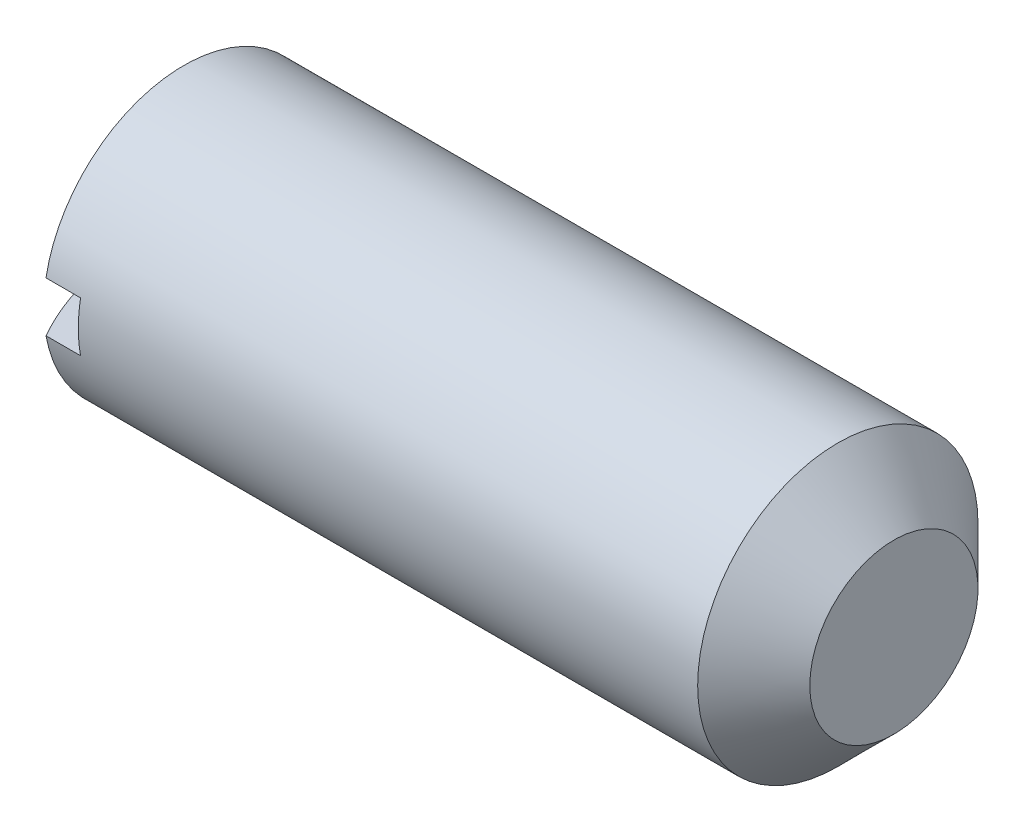
from build123d import *

# Parameters (mm, degrees)
SKETCH2_W  = 19.05
SKETCH2_H  = 3.4036
SLOT_DEPTH = 4.9022


with BuildPart() as part:
    # BodySke → BaseBody (revolve)
    with BuildSketch(Plane.XY):
        with BuildLine():
            Line((50.8, 0), (50.8, 5.715))
            Line((50.8, 5.715), (46.99, 9.525))
            Line((46.99, 9.525), (2.552216058, 9.525))
            ThreePointArc((2.552216058, 9.525), (0.649113009, 4.930502809), (0, 0))
            Line((0, 0), (50.8, 0))
        make_face()
    revolve(axis=Axis((-12.7, 0, 0), (1, 0, 0)))

    # Sketch2 → Slot (cut)
    with BuildSketch(Plane(origin=(0, 0, 0), x_dir=(0, 0, -1), z_dir=(1, 0, 0))):
        Rectangle(SKETCH2_W, SKETCH2_H)
    extrude(amount=SLOT_DEPTH, mode=Mode.SUBTRACT)


solid = part.part
